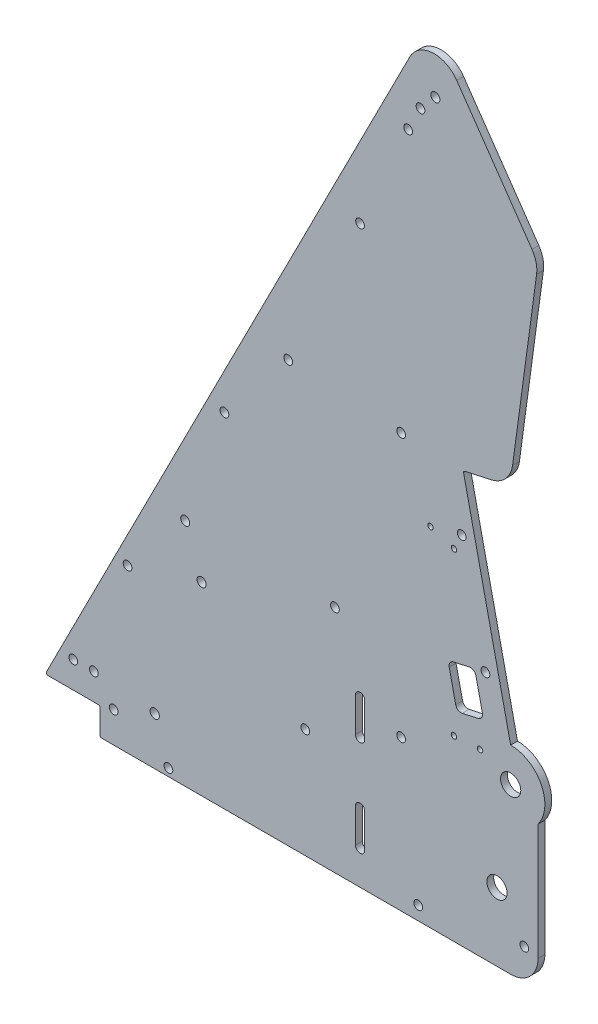
from build123d import *

# Parameters (mm, degrees)
BOSS_EXTRUDE1_DEPTH     = 3.175
SKETCH2_R               = 2.0955
SKETCH2_R_2             = 2.032
SKETCH2_R_3             = 4.699
CUT_EXTRUDE1_DEPTH      = 421.976111717
SKETCH7_R               = 2.159
SKETCH7_R_2             = 2.032
CUT_EXTRUDE2_DEPTH      = 421.976111717
CUT_EXTRUDE3_REACH      = 422.976
SKETCH10_R              = 2.032
FILLET1_R               = 12.7
FILLET2_R               = 0.79375
SKETCH12_R              = 2.032
CUT_EXTRUDE5_DEPTH      = 411.989226146
CUT_EXTRUDE6_DEPTH      = 411.989226146
CUT_EXTRUDE6_DEPTH_BACK = 411.989226146
SKETCH13_R              = 1.27
CUT_EXTRUDE7_REACH      = 412.989
SKETCH14_R              = 2.032
SKETCH15_R              = 2.032
CUT_EXTRUDE8_DEPTH      = 411.989226146
FILLET3_R               = 2.54


with BuildPart() as part:
    # Sketch1 → Boss-Extrude1 (new body)
    with BuildSketch(Plane.XY):
        with BuildLine():
            Line((228.6, -12.7), (228.6, 53.975))
            ThreePointArc((228.6, 53.975), (230.099031657, 70.599515829), (215.9, 79.375))
            Line((215.9, 79.375), (193.909735224, 178.566674323))
            Line((193.909735224, 178.566674323), (215.607913982, 183.377044743))
            Line((215.607913982, 183.377044743), (228.6, 279.4))
            Line((228.6, 279.4), (178.754725958, 351.413083686))
            Line((178.754725958, 351.413083686), (0, 0))
            Line((0, 0), (25.4, 0))
            Line((25.4, 0), (25.4, -12.7))
            Line((25.4, -12.7), (228.6, -12.7))
        make_face()
    extrude(amount=BOSS_EXTRUDE1_DEPTH)

    # Sketch2 → Cut-Extrude1 (cut, through all)
    with BuildSketch(Plane.XY.offset(3.175)):
        with Locations((64.943150167, 94.057839899)):
            Circle(SKETCH2_R)
        with Locations((180.975, 322.164313376)):
            Circle(SKETCH2_R)
        with Locations((72.544547852, 73.173171402)):
            Circle(SKETCH2_R)
        with Locations((193.207821773, 152.394364194)):
            Circle(SKETCH2_R_2)
        with Locations((215.9, 63.5)):
            Circle(SKETCH2_R_3)
        with Locations((173.0375, -6.35)):
            Circle(SKETCH2_R_2)
        with Locations((204.202954161, 102.798527032)):
            Circle(SKETCH2_R_2)
        with Locations((209.55, 19.05)):
            Circle(SKETCH2_R_3)
        with Locations((165.1, 179.3875)):
            Circle(SKETCH2_R_2)
    extrude(amount=-CUT_EXTRUDE1_DEPTH, mode=Mode.SUBTRACT)

    # Sketch7 → Cut-Extrude2 (cut, through all)
    with BuildSketch(Plane.XY.offset(3.175)):
        with Locations((50.8, 9.525)):
            Circle(SKETCH7_R)
        with Locations((134.393547852, 93.98)):
            Circle(SKETCH7_R_2)
        with BuildLine():
            Line((143.891, 3.175), (143.891, 19.05))
            ThreePointArc((143.891, 19.05), (146.05, 21.209), (148.209, 19.05))
            Line((148.209, 19.05), (148.209, 3.175))
            ThreePointArc((148.209, 3.175), (146.05, 1.016), (143.891, 3.175))
        make_face()
        with BuildLine():
            Line((143.891, 47.625), (143.891, 63.5))
            ThreePointArc((143.891, 63.5), (146.05, 65.659), (148.209, 63.5))
            Line((148.209, 63.5), (148.209, 47.625))
            ThreePointArc((148.209, 47.625), (146.05, 45.466), (143.891, 47.625))
        make_face()
    extrude(amount=-CUT_EXTRUDE2_DEPTH, mode=Mode.SUBTRACT)

    # Sketch10 → Cut-Extrude3 (cut, up to next)
    with BuildSketch(Plane.XY.offset(3.175), mode=Mode.PRIVATE) as cut_extrude3_sk1:
        with Locations((165.1, 57.15)):
            Circle(SKETCH10_R)
    cut_extrude3_tool1 = extrude(cut_extrude3_sk1.sketch, amount=-CUT_EXTRUDE3_REACH, mode=Mode.PRIVATE) & part.part
    # Sketch10 → Cut-Extrude3 (cut, up to next)
    with BuildSketch(Plane.XY.offset(3.175), mode=Mode.PRIVATE) as cut_extrude3_sk2:
        with Locations((120.65, 38.1)):
            Circle(SKETCH10_R)
    cut_extrude3_tool2 = extrude(cut_extrude3_sk2.sketch, amount=-CUT_EXTRUDE3_REACH, mode=Mode.PRIVATE) & part.part
    # Sketch10 → Cut-Extrude3 (cut, up to next)
    with BuildSketch(Plane.XY.offset(3.175), mode=Mode.PRIVATE) as cut_extrude3_sk3:
        with Locations((13.046467246, 12.334704411)):
            Circle(SKETCH10_R)
    cut_extrude3_tool3 = extrude(cut_extrude3_sk3.sketch, amount=-CUT_EXTRUDE3_REACH, mode=Mode.PRIVATE) & part.part
    # Sketch10 → Cut-Extrude3 (cut, up to next)
    with BuildSketch(Plane.XY.offset(3.175), mode=Mode.PRIVATE) as cut_extrude3_sk4:
        with Locations((22.571467246, 12.334704411)):
            Circle(SKETCH10_R)
    cut_extrude3_tool4 = extrude(cut_extrude3_sk4.sketch, amount=-CUT_EXTRUDE3_REACH, mode=Mode.PRIVATE) & part.part
    # Sketch10 → Cut-Extrude3 (cut, up to next)
    with BuildSketch(Plane.XY.offset(3.175), mode=Mode.PRIVATE) as cut_extrude3_sk5:
        with Locations((38.211447917, 62.639810909)):
            Circle(SKETCH10_R)
    cut_extrude3_tool5 = extrude(cut_extrude3_sk5.sketch, amount=-CUT_EXTRUDE3_REACH, mode=Mode.PRIVATE) & part.part
    add(cut_extrude3_tool1.solids().sort_by_distance((165.1, 57.15, 3.175))[0], mode=Mode.SUBTRACT)
    add(cut_extrude3_tool2.solids().sort_by_distance((120.65, 38.1, 3.175))[0], mode=Mode.SUBTRACT)
    add(cut_extrude3_tool3.solids().sort_by_distance((13.046467, 12.334704, 3.175))[0], mode=Mode.SUBTRACT)
    add(cut_extrude3_tool4.solids().sort_by_distance((22.571467, 12.334704, 3.175))[0], mode=Mode.SUBTRACT)
    add(cut_extrude3_tool5.solids().sort_by_distance((38.211448, 62.639811, 3.175))[0], mode=Mode.SUBTRACT)

    # Fillet1
    fillet1_edges = [part.edges().sort_by_distance(p)[0] for p in [
        (228.6, -12.7, 1.5875),
        (178.754725958, 351.413083686, 1.5875),
        (215.607913982, 183.377044743, 1.5875),
        (228.6, 279.4, 1.5875),
    ]]
    fillet(fillet1_edges, radius=FILLET1_R)

    # Fillet2
    fillet2_edges = [part.edges().sort_by_distance(p)[0] for p in [
        (25.4, -12.7, 1.5875),
        (25.4, 0, 1.5875),
        (193.909735224, 178.566674323, 1.5875),
        (0, 0, 1.5875),
    ]]
    fillet(fillet2_edges, radius=FILLET2_R)

    # Sketch12 → Cut-Extrude5 (cut, through all)
    with BuildSketch(Plane.XY.offset(3.175)):
        with Locations((31.75, 1.5875)):
            Circle(SKETCH12_R)
        with Locations((222.25, 1.5875)):
            Circle(SKETCH12_R)
        with Locations((57.15, -9.2075)):
            Circle(SKETCH12_R)
    extrude(amount=-CUT_EXTRUDE5_DEPTH, mode=Mode.SUBTRACT)

    # Sketch13 → Cut-Extrude6 (cut, two sides: drawn at the far end of the back side and taken through both)
    with BuildSketch(Plane.XY.offset(3.175).offset(-CUT_EXTRUDE6_DEPTH_BACK)):
        with Locations((189.602197334, 69.980636704)):
            Circle(SKETCH13_R)
        with Locations((201.708862449, 70.509225118)):
            Circle(SKETCH13_R)
        with Locations((178.721644858, 148.532438598)):
            Circle(SKETCH13_R)
        with Locations((189.622629605, 145.09537131)):
            Circle(SKETCH13_R)
        Polygon((186.844411154, 98.950230697), (199.243370445, 101.699013794), (203.36654509, 83.100574858), (190.9675858, 80.351791761), align=None)
    extrude(amount=CUT_EXTRUDE6_DEPTH + CUT_EXTRUDE6_DEPTH_BACK, mode=Mode.SUBTRACT)

    # Sketch14 → Cut-Extrude7 (cut, up to next)
    with BuildSketch(Plane.XY.offset(3.175), mode=Mode.PRIVATE) as cut_extrude7_sk1:
        with Locations((146.05, 254)):
            Circle(SKETCH14_R)
    cut_extrude7_tool1 = extrude(cut_extrude7_sk1.sketch, amount=-CUT_EXTRUDE7_REACH, mode=Mode.PRIVATE) & part.part
    # Sketch14 → Cut-Extrude7 (cut, up to next)
    with BuildSketch(Plane.XY.offset(3.175), mode=Mode.PRIVATE) as cut_extrude7_sk2:
        with Locations((112.7125, 182.5625)):
            Circle(SKETCH14_R)
    cut_extrude7_tool2 = extrude(cut_extrude7_sk2.sketch, amount=-CUT_EXTRUDE7_REACH, mode=Mode.PRIVATE) & part.part
    add(cut_extrude7_tool1.solids().sort_by_distance((146.05, 254, 3.175))[0], mode=Mode.SUBTRACT)
    add(cut_extrude7_tool2.solids().sort_by_distance((112.7125, 182.5625, 3.175))[0], mode=Mode.SUBTRACT)

    # Sketch15 → Cut-Extrude8 (cut, through all)
    with BuildSketch(Plane.XY.offset(3.175)):
        with Locations((83.136819993, 146.631489078)):
            Circle(SKETCH15_R)
        with Locations((174.099451819, 314.249971331)):
            Circle(SKETCH15_R)
        with Locations((168.341424743, 302.930292705)):
            Circle(SKETCH15_R)
    extrude(amount=-CUT_EXTRUDE8_DEPTH, mode=Mode.SUBTRACT)

    # Fillet3
    fillet3_edges = [part.edges().sort_by_distance(p)[0] for p in [
        (199.243370445, 101.699013794, 1.5875),
        (186.844411154, 98.950230697, 1.5875),
        (190.9675858, 80.351791761, 1.5875),
        (203.36654509, 83.100574858, 1.5875),
    ]]
    fillet(fillet3_edges, radius=FILLET3_R)


solid = part.part
